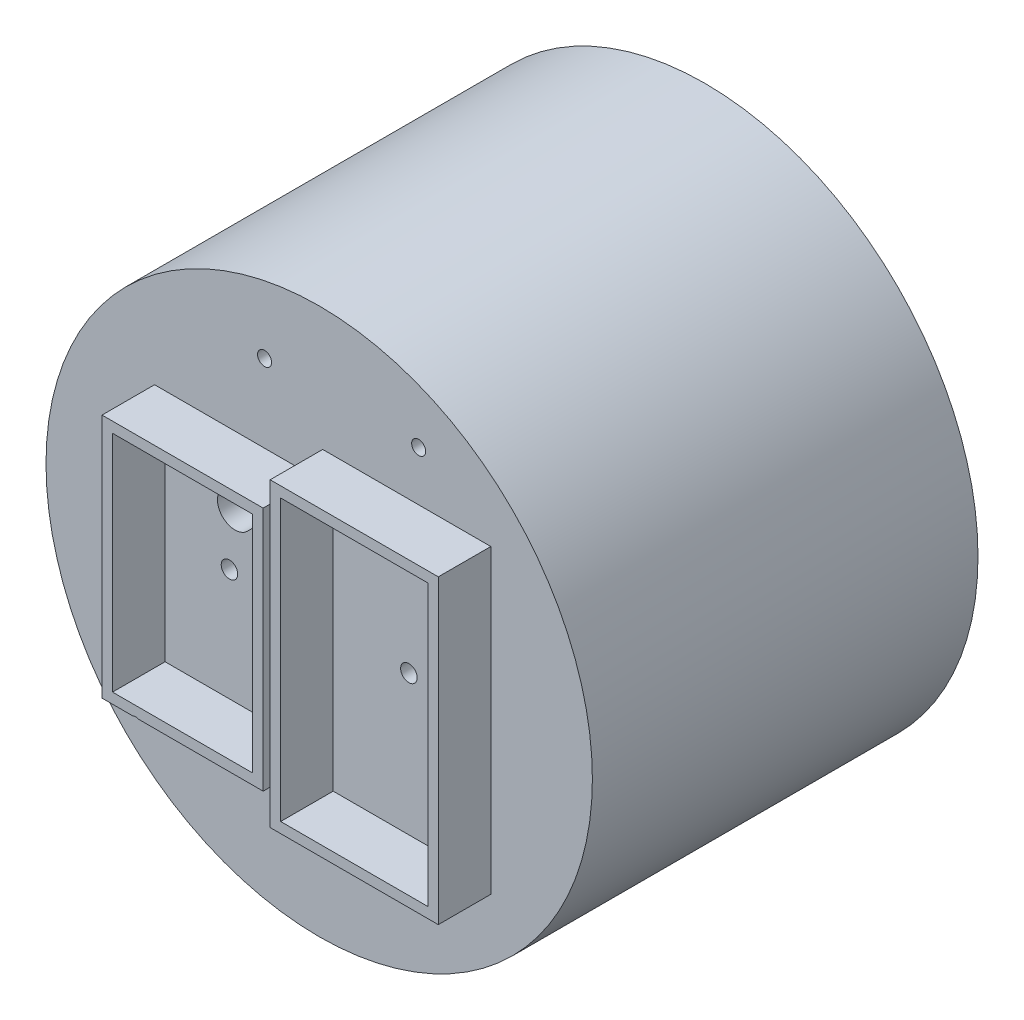
from build123d import *

# Parameters (mm, degrees)
CUT_EXTRUDE2_DEPTH  = 12.7
SKETCH4_3_R         = 1.5
CUT_EXTRUDE3_DEPTH  = 9.525
SKETCH6_W           = 25.4
SKETCH6_H           = 40.64
SKETCH6_W_2         = 30.48
SKETCH6_H_2         = 54.61
SKETCH6_W_3         = 26.67
SKETCH6_H_3         = 50.8
BOSS_EXTRUDE2_DEPTH = 9.525
CUT_EXTRUDE4_START  = -9.525
SKETCH6_3_R         = 1.27
CUT_EXTRUDE4_DEPTH  = 9.525


with BuildPart() as part:
    # Sketch2 → Revolve1 (revolve)
    with BuildSketch(Plane(origin=(0, 0, 0), x_dir=(0, 0, -1), z_dir=(1, 0, 0))):
        Polygon((0, 0), (0, 12.5857), (4.4704, 13.9065), (4.4704, 16.4465), (0, 16.4465), (0, 44.45), (59.751152593, 44.45), (59.751152593, 39.37), (64.831152593, 39.37), (64.831152593, 49.53), (-5.08, 49.53), (-5.08, 0), align=None)
    revolve(axis=Axis((0, 0, 0), (0, 0, 1)))

    # Sketch4 → Cut-Extrude2 (cut)
    with BuildSketch(Plane.XY):
        with BuildLine():
            Line((-4.1656, -12.04250002), (-4.1656, -10.483480973))
            ThreePointArc((-4.1656, -10.483480973), (-6.016064494, -6.016064494), (-10.483480973, -4.1656))
            Line((-10.483480973, -4.1656), (-16.265, -4.1656))
            ThreePointArc((-16.265, -4.1656), (-20.4306, 0), (-16.265, 4.1656))
            Line((-16.265, 4.1656), (-12.04250002, 4.1656))
            Line((-12.04250002, 4.1656), (-10.483480973, 4.1656))
            ThreePointArc((-10.483480973, 4.1656), (-6.016064494, 6.016064494), (-4.1656, 10.483480973))
            Line((-4.1656, 10.483480973), (-4.1656, 12.04250002))
            Line((-4.1656, 12.04250002), (-4.1656, 16.265))
            ThreePointArc((-4.1656, 16.265), (0, 20.4306), (4.1656, 16.265))
            Line((4.1656, 16.265), (4.1656, 12.04250002))
            Line((4.1656, 12.04250002), (4.1656, 10.483480973))
            ThreePointArc((4.1656, 10.483480973), (6.016064494, 6.016064494), (10.483480973, 4.1656))
            Line((10.483480973, 4.1656), (12.04250002, 4.1656))
            Line((12.04250002, 4.1656), (16.265, 4.1656))
            ThreePointArc((16.265, 4.1656), (20.4306, 0), (16.265, -4.1656))
            Line((16.265, -4.1656), (12.04250002, -4.1656))
            Line((12.04250002, -4.1656), (10.483480973, -4.1656))
            ThreePointArc((10.483480973, -4.1656), (6.016064494, -6.016064494), (4.1656, -10.483480973))
            Line((4.1656, -10.483480973), (4.1656, -12.04250002))
            Line((4.1656, -12.04250002), (4.1656, -16.265))
            ThreePointArc((4.1656, -16.265), (0, -20.4306), (-4.1656, -16.265))
            Line((-4.1656, -16.265), (-4.1656, -12.04250002))
        make_face()
    extrude(amount=-CUT_EXTRUDE2_DEPTH, mode=Mode.SUBTRACT)

    # Sketch4<3> → Cut-Extrude3 (cut)
    with BuildSketch(Plane.XY):
        with BuildLine():
            Line((-13.021371376, 7.633217703), (-7.633217703, 13.021371376))
            ThreePointArc((-7.633217703, 13.021371376), (-7.633217703, 17.511499436), (-12.123345763, 17.511499436))
            Line((-12.123345763, 17.511499436), (-17.511499436, 12.123345763))
            ThreePointArc((-17.511499436, 12.123345763), (-17.511499436, 7.633217703), (-13.021371376, 7.633217703))
        make_face()
        with Locations((16.265, 0)):
            Circle(SKETCH4_3_R)
        with Locations((0, 16.265)):
            Circle(SKETCH4_3_R)
        with Locations((-16.265, 0)):
            Circle(SKETCH4_3_R)
        with Locations((0, -16.265)):
            Circle(SKETCH4_3_R)
    extrude(amount=CUT_EXTRUDE3_DEPTH, mode=Mode.SUBTRACT)

    # Sketch6 → Boss-Extrude2 (add)
    # profile 1 of 2: a face of its own
    with BuildSketch(Plane.XY.offset(5.08)):
        with BuildLine():
            Line((-0.635, 22.225), (-29.845, 22.225))
            Line((-29.845, 22.225), (-29.845, -22.225))
            Line((-29.845, -22.225), (-24.302580166, -22.225))
            ThreePointArc((-24.302580166, -22.225), (-23.749, -22.098), (-23.195419834, -22.225))
            Line((-23.195419834, -22.225), (-0.635, -22.225))
            Line((-0.635, -22.225), (-0.635, 22.225))
        make_face()
        with Locations((-15.24, 0)):
            Rectangle(SKETCH6_W, SKETCH6_H, mode=Mode.SUBTRACT)
    # profile 2 of 2: a face of its own
    with BuildSketch(Plane.XY.offset(5.08)):
        with Locations((15.875, 0)):
            Rectangle(SKETCH6_W_2, SKETCH6_H_2)
        with Locations((15.875, 0)):
            Rectangle(SKETCH6_W_3, SKETCH6_H_3, mode=Mode.SUBTRACT)
    extrude(amount=BOSS_EXTRUDE2_DEPTH)

    # Sketch6<3> → Cut-Extrude4 (cut)
    with BuildSketch(Plane.XY.offset(5.08).offset(CUT_EXTRUDE4_START)):
        with BuildLine():
            Line((-23.195419834, -22.225), (-24.302580166, -22.225))
            ThreePointArc((-24.302580166, -22.225), (-23.749, -24.638), (-23.195419834, -22.225))
        make_face()
        with Locations((-9.906, 36.322)):
            Circle(SKETCH6_3_R)
        with Locations((23.114, -15.748)):
            Circle(SKETCH6_3_R)
        with Locations((18.034, 36.322)):
            Circle(SKETCH6_3_R)
    extrude(amount=CUT_EXTRUDE4_DEPTH, mode=Mode.SUBTRACT)


solid = part.part
